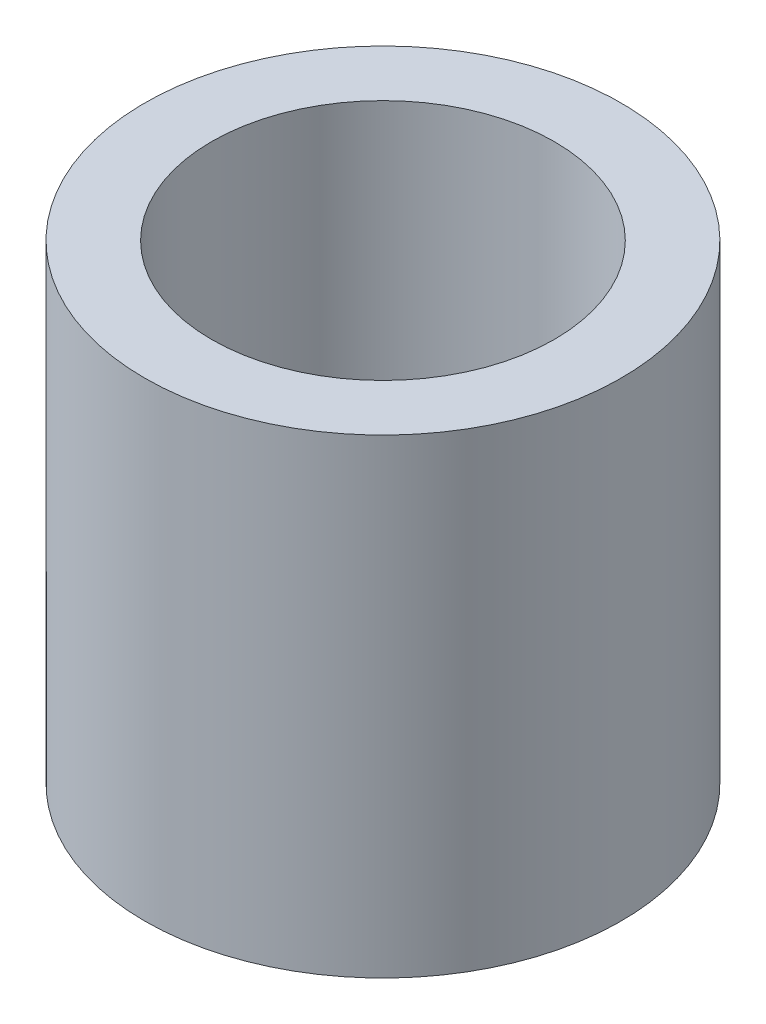
from build123d import *

# Parameters (mm, degrees)
SKETCH1_R           = 22.5
BOSS_EXTRUDE1_DEPTH = 44.406239389
SKETCH2_R           = 16.184909708
CUT_EXTRUDE1_DEPTH  = 55.629791293


with BuildPart() as part:
    # Sketch1 → Boss-Extrude1 (new body)
    with BuildSketch(Plane(origin=(0, 0, 0), x_dir=(1, 0, 0), z_dir=(0, 1, 0))):
        Circle(SKETCH1_R)
    extrude(amount=BOSS_EXTRUDE1_DEPTH)

    # Sketch2 → Cut-Extrude1 (cut, through all)
    with BuildSketch(Plane(origin=(0, 0, 0), x_dir=(1, 0, 0), z_dir=(0, 1, 0))):
        Circle(SKETCH2_R)
    extrude(amount=CUT_EXTRUDE1_DEPTH, mode=Mode.SUBTRACT)


solid = part.part
